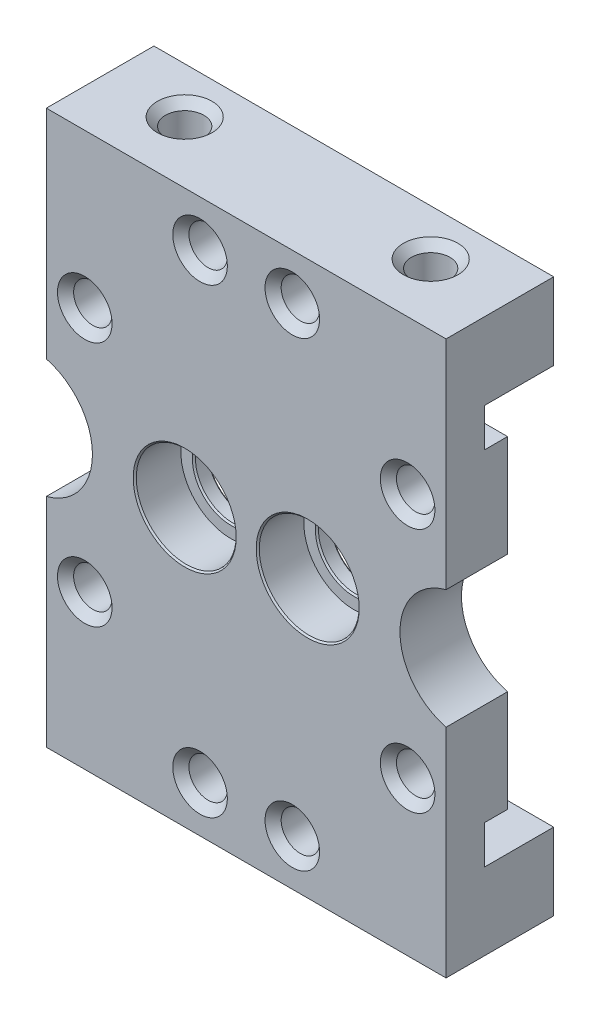
from build123d import *

# Parameters (mm, degrees)
SKETCH_1_W                   = 26
SKETCH_1_H                   = 7
EXTRUDE_1_DEPTH              = 36
CUT_EXTRUDE_1_DEPTH          = 45.544921147
HOLE_WIZARD_M32_D            = 2.5
HOLE_WIZARD_M32_DEPTH        = 5
HOLE_WIZARD_M32_CSINK_D      = 3.55
HOLE_WIZARD_M32_CSINK_ANGLE  = 90
HOLE_WIZARD_M33_D            = 2.5
HOLE_WIZARD_M33_DEPTH        = 5
HOLE_WIZARD_M33_CSINK_D      = 3.55
HOLE_WIZARD_M33_CSINK_ANGLE  = 90
CUT_EXTRUDE_4_DEPTH          = 39.910152917
HOLE_WIZARD_M31_9_AT_2_COUNT = 2
HOLE_WIZARD_M31_9_AT_2_PITCH = 8


# Read off the part's stored shape, not the designer's step: Отверстие обработанное метчиком M31
with BuildPart() as part:
    # Эскиз1 → Бобышка-Вытянуть1 (new body)
    with BuildSketch(Plane(origin=(0, 0, 0), x_dir=(1, 0, 0), z_dir=(0, 1, 0))):
        Rectangle(SKETCH_1_W, SKETCH_1_H)
    extrude(amount=EXTRUDE_1_DEPTH)

    # Эскиз2 → Вырез-Вытянуть1 (cut, through all)
    with BuildSketch(Plane.ZY.offset(13)):
        Polygon((-77.060994328, 31), (-3.5, 31), (1, 31), (1, 28.5), (-0.5, 28.5), (-0.5, 7.5), (1, 7.5), (1, 5), (-3.5, 5), (-77.060994328, 5), (-224.182982985, 5), (-224.182982985, 31), align=None)
    extrude(amount=-CUT_EXTRUDE_1_DEPTH, mode=Mode.SUBTRACT)

    # Hole Wizard M31 outline → Hole Wizard M31 (revolve, cut)
    with BuildSketch(Plane(origin=(10.5, 26, 0), x_dir=(1, 0, 0), z_dir=(0, -1, 0))):
        Polygon((0, -0.5), (1.775, -0.5), (1.25, 0.025), (1.25, 2.975), (1.775, 3.5), (0, 3.5), align=None)
    revolve(axis=Axis((10.5, 26, 0), (0, 0, 1)), mode=Mode.SUBTRACT)

    # Hole Wizard M31 2 outline → Hole Wizard M31 2 (revolve, cut)
    with BuildSketch(Plane(origin=(-10.5, 10, 0), x_dir=(1, 0, 0), z_dir=(0, -1, 0))):
        Polygon((0, -0.5), (1.775, -0.5), (1.25, 0.025), (1.25, 2.975), (1.775, 3.5), (0, 3.5), align=None)
    revolve(axis=Axis((-10.5, 10, 0), (0, 0, 1)), mode=Mode.SUBTRACT)

    # Hole Wizard M31 3 outline → Hole Wizard M31 3 (revolve, cut)
    with BuildSketch(Plane(origin=(-10.5, 26, 0), x_dir=(1, 0, 0), z_dir=(0, -1, 0))):
        Polygon((0, -0.5), (1.775, -0.5), (1.25, 0.025), (1.25, 2.975), (1.775, 3.5), (0, 3.5), align=None)
    revolve(axis=Axis((-10.5, 26, 0), (0, 0, 1)), mode=Mode.SUBTRACT)

    # Hole Wizard M31 4 outline → Hole Wizard M31 4 (revolve, cut)
    with BuildSketch(Plane(origin=(10.5, 10, 0), x_dir=(1, 0, 0), z_dir=(0, -1, 0))):
        Polygon((0, -0.5), (1.775, -0.5), (1.25, 0.025), (1.25, 2.975), (1.775, 3.5), (0, 3.5), align=None)
    revolve(axis=Axis((10.5, 10, 0), (0, 0, 1)), mode=Mode.SUBTRACT)

    # Hole Wizard M31 5 outline → Hole Wizard M31 5 (revolve, cut)
    with BuildSketch(Plane(origin=(-3, 33, 0), x_dir=(1, 0, 0), z_dir=(0, -1, 0))):
        Polygon((0, -3.5), (1.775, -3.5), (1.25, -2.975), (1.25, 2.975), (1.775, 3.5), (0, 3.5), align=None)
    revolve(axis=Axis((-3, 33, 0), (0, 0, 1)), mode=Mode.SUBTRACT)

    # Hole Wizard M31 6 outline → Hole Wizard M31 6 (revolve, cut)
    with BuildSketch(Plane(origin=(3, 3, 0), x_dir=(1, 0, 0), z_dir=(0, -1, 0))):
        Polygon((0, -3.5), (1.775, -3.5), (1.25, -2.975), (1.25, 2.975), (1.775, 3.5), (0, 3.5), align=None)
    revolve(axis=Axis((3, 3, 0), (0, 0, 1)), mode=Mode.SUBTRACT)

    # Hole Wizard M31 7 outline → Hole Wizard M31 7 (revolve, cut)
    with BuildSketch(Plane(origin=(-3, 3, 0), x_dir=(1, 0, 0), z_dir=(0, -1, 0))):
        Polygon((0, -3.5), (1.775, -3.5), (1.25, -2.975), (1.25, 2.975), (1.775, 3.5), (0, 3.5), align=None)
    revolve(axis=Axis((-3, 3, 0), (0, 0, 1)), mode=Mode.SUBTRACT)

    # Hole Wizard M31 8 outline → Hole Wizard M31 8 (revolve, cut)
    with BuildSketch(Plane(origin=(3, 33, 0), x_dir=(1, 0, 0), z_dir=(0, -1, 0))):
        Polygon((0, -3.5), (1.775, -3.5), (1.25, -2.975), (1.25, 2.975), (1.775, 3.5), (0, 3.5), align=None)
    revolve(axis=Axis((3, 33, 0), (0, 0, 1)), mode=Mode.SUBTRACT)

    # Отверстие обработанное метчиком M32
    with Locations(Plane.XZ):
        with Locations((8, -0.5), (-8, -0.5)):
            CounterSinkHole(HOLE_WIZARD_M32_D / 2, HOLE_WIZARD_M32_CSINK_D / 2, depth=HOLE_WIZARD_M32_DEPTH, counter_sink_angle=HOLE_WIZARD_M32_CSINK_ANGLE)

    # Отверстие обработанное метчиком M33
    with Locations(Plane(origin=(0, 36, 0), x_dir=(-1, 0, 0), z_dir=(0, 1, 0))):
        with Locations((8, -0.5), (-8, -0.5)):
            CounterSinkHole(HOLE_WIZARD_M33_D / 2, HOLE_WIZARD_M33_CSINK_D / 2, depth=HOLE_WIZARD_M33_DEPTH, counter_sink_angle=HOLE_WIZARD_M33_CSINK_ANGLE)

    # Эскиз10 → Вырез-Вытянуть4 (cut, through all)
    with BuildSketch(Plane.XY.offset(3.5)):
        with BuildLine():
            ThreePointArc((-13, 14.127016654), (-10, 18), (-13, 21.872983346))
            Line((-13, 21.872983346), (-13, 14.127016654))
        make_face()
        with BuildLine():
            Line((13, 14.127016654), (13, 21.872983346))
            ThreePointArc((13, 21.872983346), (10, 18), (13, 14.127016654))
        make_face()
    extrude(amount=-CUT_EXTRUDE_4_DEPTH, mode=Mode.SUBTRACT)

    # Эскиз11 → Hole Wizard M31 9 (revolve, cut)
    with BuildSketch(Plane(origin=(-4, 18, 3.5), x_dir=(0, -1, 0), z_dir=(1, 0, 0))):
        Polygon((0, 0), (0, 4), (2.5, 4), (2.4, 3.9), (2.4, 3.1), (2.5, 3), (3.25, 3), (3.25, 0.1), (3.35, 0), align=None)
    hole_wizard_m31_9 = revolve(axis=Axis((-4, 18, 9.85), (0, 0, -1)), mode=Mode.SUBTRACT)

    # Hole Wizard M31 9 at 2: Hole Wizard M31 9 ×2
    with Locations(*[(i * HOLE_WIZARD_M31_9_AT_2_PITCH, 0, 0) for i in range(1, HOLE_WIZARD_M31_9_AT_2_COUNT)]):
        add(hole_wizard_m31_9, mode=Mode.SUBTRACT)


solid = part.part
